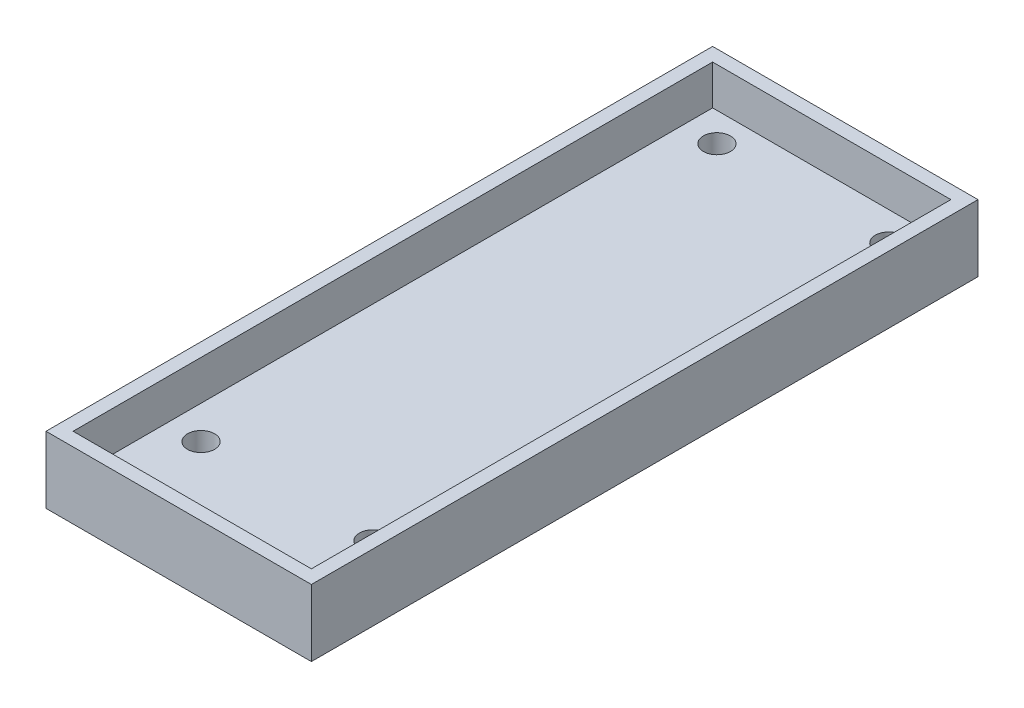
from build123d import *

# Parameters (mm, degrees)
SKETCH1_W               = 29.4
SKETCH1_H               = 73.85
BOSS_EXTRUDE1_DEPTH     = 3
SKETCH1_3_W             = 29.4
SKETCH1_3_H             = 73.85
SKETCH1_3_W_2           = 26.4
SKETCH1_3_H_2           = 70.85
BOSS_EXTRUDE2_DEPTH     = 4.4
CUT_EXTRUDE1_DEPTH      = 40.986317973
CUT_EXTRUDE1_DEPTH_BACK = 40.986317973
SKETCH2_R               = 1.5


with BuildPart() as part:
    # Sketch1 → Boss-Extrude1 (new body)
    with BuildSketch(Plane(origin=(0, 0, 0), x_dir=(1, 0, 0), z_dir=(0, 1, 0))):
        Rectangle(SKETCH1_W, SKETCH1_H)
    extrude(amount=-BOSS_EXTRUDE1_DEPTH)

    # Sketch1<3> → Boss-Extrude2 (add)
    with BuildSketch(Plane(origin=(0, 0, 0), x_dir=(1, 0, 0), z_dir=(0, 1, 0))):
        Rectangle(SKETCH1_3_W, SKETCH1_3_H)
        Rectangle(SKETCH1_3_W_2, SKETCH1_3_H_2, mode=Mode.SUBTRACT)
    extrude(amount=BOSS_EXTRUDE2_DEPTH)

    # Sketch2 → Cut-Extrude1 (cut, two sides: drawn at the far end of the back side and taken through both)
    with BuildSketch(Plane(origin=(0, 0, 0), x_dir=(1, 0, 0), z_dir=(0, 1, 0)).offset(-CUT_EXTRUDE1_DEPTH_BACK)):
        with Locations((-9.525, 32.225)):
            Circle(SKETCH2_R)
        with Locations((9.525, 32.225)):
            Circle(SKETCH2_R)
        with Locations((-9.525, -24.925)):
            Circle(SKETCH2_R)
        with Locations((9.525, -24.925)):
            Circle(SKETCH2_R)
    extrude(amount=CUT_EXTRUDE1_DEPTH + CUT_EXTRUDE1_DEPTH_BACK, mode=Mode.SUBTRACT)


solid = part.part
